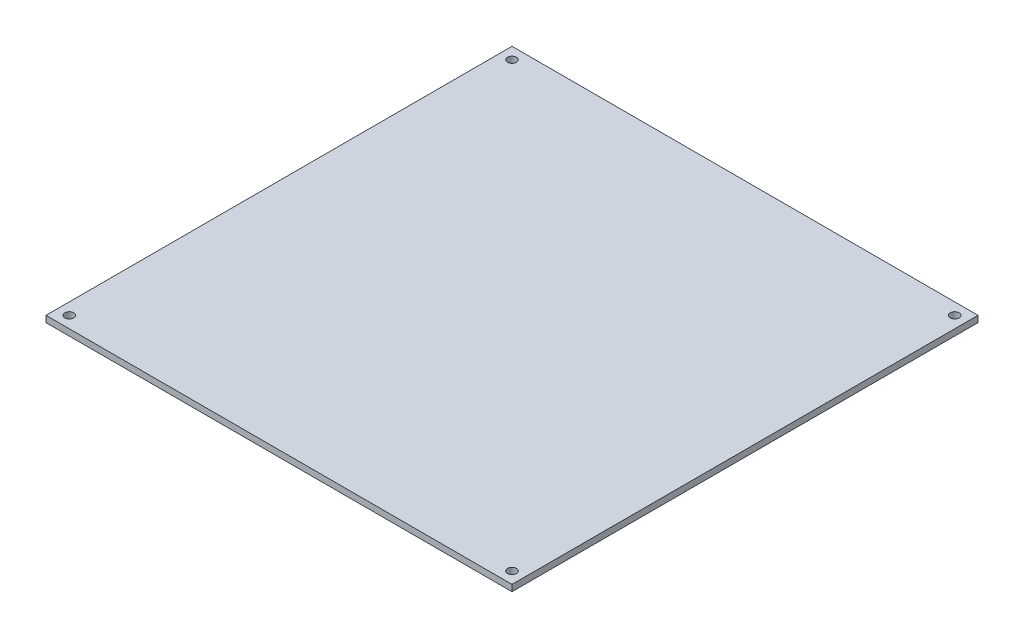
from build123d import *

# Parameters (mm, degrees)
SKETCH1_W           = 220
SKETCH1_H           = 220
SKETCH1_R           = 2.100025747
BOSS_EXTRUDE1_DEPTH = 3


with BuildPart() as part:
    # Sketch1 → Boss-Extrude1 (new body)
    with BuildSketch(Plane(origin=(0, 0, 0), x_dir=(1, 0, 0), z_dir=(0, 1, 0))):
        Rectangle(SKETCH1_W, SKETCH1_H)
        with Locations((-104.5, 104.5)):
            Circle(SKETCH1_R, mode=Mode.SUBTRACT)
        with Locations((104.5, 104.5)):
            Circle(SKETCH1_R, mode=Mode.SUBTRACT)
        with Locations((104.5, -104.5)):
            Circle(SKETCH1_R, mode=Mode.SUBTRACT)
        with Locations((-104.5, -104.5)):
            Circle(SKETCH1_R, mode=Mode.SUBTRACT)
    extrude(amount=BOSS_EXTRUDE1_DEPTH)


solid = part.part
